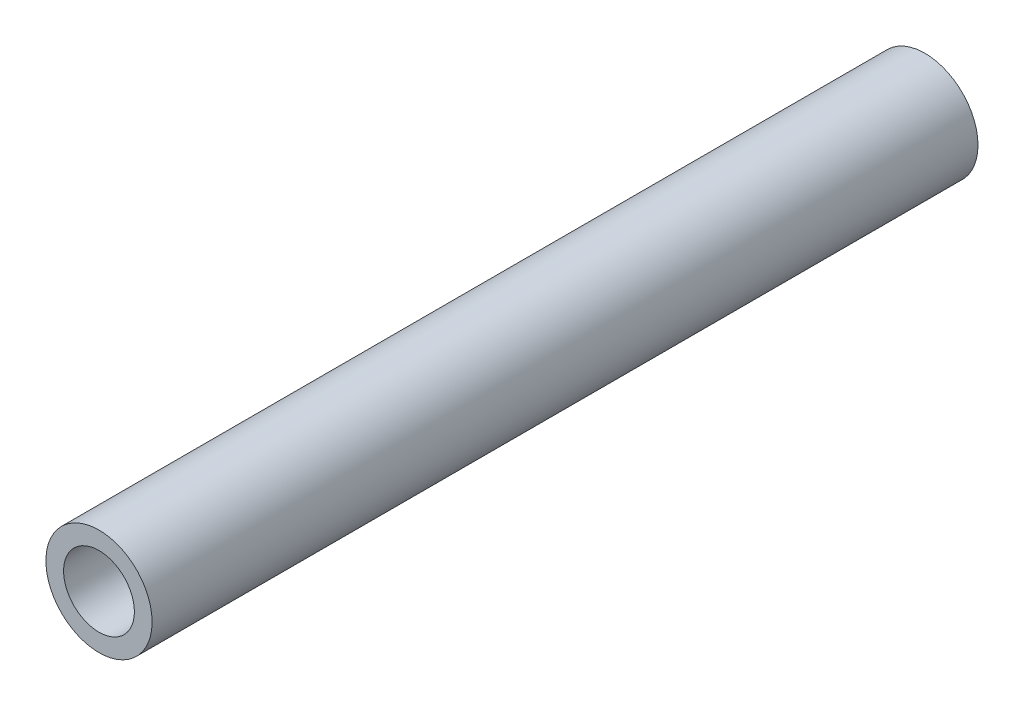
from build123d import *

# Parameters (mm, degrees)
SKETCH1_R           = 2.25
SKETCH1_R_2         = 1.5
BOSS_EXTRUDE1_DEPTH = 35


with BuildPart() as part:
    # Sketch1 → Boss-Extrude1 (new body)
    with BuildSketch(Plane.XY):
        Circle(SKETCH1_R)
        Circle(SKETCH1_R_2, mode=Mode.SUBTRACT)
    extrude(amount=BOSS_EXTRUDE1_DEPTH)


solid = part.part
